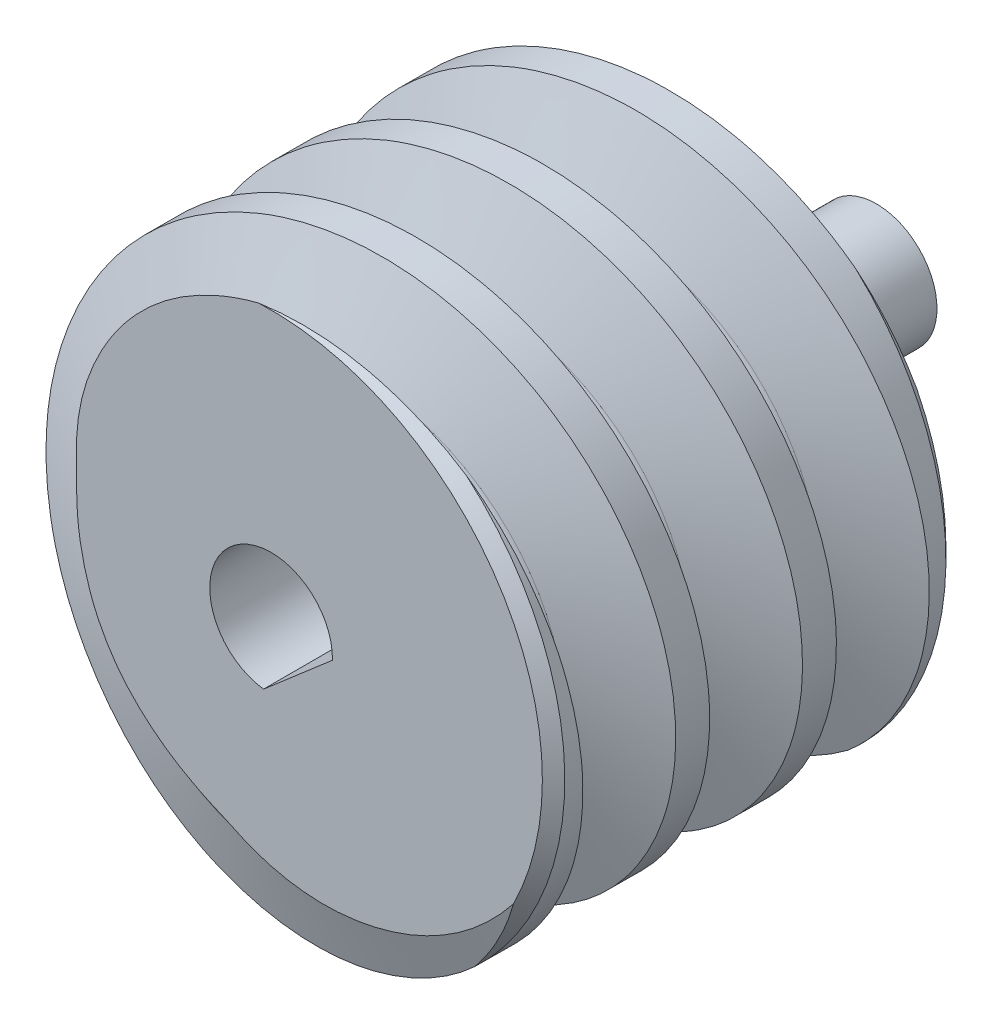
from build123d import *

# Parameters (mm, degrees)
TOOTHCUTWORM01_PITCH = 3.141592606
CUT_EXTRUDE_1_DEPTH  = 15.071247435
SKETCH_4_R           = 2.5
SKETCH_4_R_2         = 1.5
EXTRUDE_2_DEPTH      = 1
EXTRUDE_START        = -1
EXTRUDE_3_DEPTH      = 6


with BuildPart() as part:
    # SketchRevolveWorm01 → Worm01 (revolve)
    with BuildSketch(Plane(origin=(0, 0, 0), x_dir=(0, 0, -1), z_dir=(1, 0, 0)), mode=Mode.PRIVATE) as worm01_sk:
        Polygon((5, 0), (5, 6.721999985), (4.722, 6.999999985), (-4.722, 6.999999985), (-5, 6.721999985), (-5, 0), align=None)
    revolve(worm01_sk.sketch.rotate(Axis((0, 0, 0), (0, 0, -1)), 90), axis=Axis((0, 0, 0), (0, 0, -1)))

    # ToothCutWorm01: the profile of SketchToothWorm01 screwed along a right-hand helix of 6 turns, 10 arcs to a turn; built about Z, then put on its axis
    toothcutworm01_z = Axis((0, 0, 0), (0, 0, 1))
    toothcutworm01_corners = [(7.249999981, 0, 1.242074472), (4.947052957, 0, 0.400713361), (4.750000019, 0, 0.118929933), (4.750000019, 0, -0.118929933), (4.947052957, 0, -0.400713361), (7.249999981, 0, -1.242074472)]
    with BuildLine(mode=Mode.PRIVATE) as toothcutworm01_profile:
        Line(toothcutworm01_corners[0], toothcutworm01_corners[1])
        Line(toothcutworm01_corners[2], toothcutworm01_corners[3])
        Line(toothcutworm01_corners[4], toothcutworm01_corners[5])
        Line(toothcutworm01_corners[5], toothcutworm01_corners[0])
        ThreePointArc((4.947052957, 0, 0.400713361), (4.804150351, 0, 0.290854161), (4.750000019, 0, 0.118929933))
        ThreePointArc((4.750000019, 0, -0.118929933), (4.804150351, 0, -0.290854161), (4.947052957, 0, -0.400713361))
    toothcutworm01_cap = Face(toothcutworm01_profile.wire())
    toothcutworm01_arcs = [((4.947052957, 0, 0.400713361), (4.750000019, 0, 0.328721832), (4.750000019, 0, 0.118929933), (1, 0.8194988901063853, 1)), ((4.750000019, 0, -0.118929933), (4.750000019, 0, -0.328721832), (4.947052957, 0, -0.400713361), (1, 0.8194988901063811, 1))]  # start, shoulder, end, weights
    toothcutworm01_turn_angles = [0, 18, 36, 54, 72, 90, 108, 126, 144, 162, 180, 198, 216, 234, 252, 270, 288, 306, 324, 342, 360]
    toothcutworm01_turn_weights = [1, 0.9510565162951535, 1, 0.9510565162951535, 1, 0.9510565162951535, 1, 0.9510565162951535, 1, 0.9510565162951535, 1, 0.9510565162951535, 1, 0.9510565162951535, 1, 0.9510565162951535, 1, 0.9510565162951535, 1, 0.9510565162951535, 1]
    toothcutworm01_turn_rails = [Edge.make_bspline([Vector(p[0], p[1], 0).rotate(toothcutworm01_z, toothcutworm01_turn_angles[k]) / toothcutworm01_turn_weights[k] + Vector(0, 0, p[2] + TOOTHCUTWORM01_PITCH * toothcutworm01_turn_angles[k] / 360) for k in range(21)], [0, 0, 0, 1, 1, 2, 2, 3, 3, 4, 4, 5, 5, 6, 6, 7, 7, 8, 8, 9, 9, 10, 10, 10], 2, toothcutworm01_turn_weights) for p in toothcutworm01_corners]
    toothcutworm01_turn_sides = [*[Face.make_surface_from_curves(toothcutworm01_turn_rails[p[0]], toothcutworm01_turn_rails[p[1]]) for p in [(0, 1), (2, 3), (4, 5), (5, 0)]], *[Face.make_bezier_surface([[Vector(p[j][0], p[j][1], 0).rotate(toothcutworm01_z, toothcutworm01_turn_angles[2 * i + k]) / toothcutworm01_turn_weights[2 * i + k] + Vector(0, 0, p[j][2] + TOOTHCUTWORM01_PITCH * toothcutworm01_turn_angles[2 * i + k] / 360) for k in range(3)] for j in range(3)], [[p[3][j] * toothcutworm01_turn_weights[2 * i + k] for k in range(3)] for j in range(3)]) for p in toothcutworm01_arcs for i in range(10)]]
    toothcutworm01 = Plane(origin=(0, 0, 9.424777819), x_dir=(1, 0, 0), z_dir=(0, 0, -1)) * Solid(Shell([*[p.moved(Location((0, 0, TOOTHCUTWORM01_PITCH * i))) for i in range(6) for p in toothcutworm01_turn_sides], toothcutworm01_cap, toothcutworm01_cap.rotate(toothcutworm01_z, 2160).moved(Location((0, 0, TOOTHCUTWORM01_PITCH * 2160 / 360)))]))
    add(toothcutworm01, mode=Mode.SUBTRACT)

    # Эскиз1 → Вырез-Вытянуть1 (cut, through all)
    with BuildSketch(Plane(origin=(0, 0, -5), x_dir=(-1, 0, 0), z_dir=(0, 0, -1))):
        with BuildLine():
            Line((-1.519579541, -0.035749375), (0.186583259, -1.508504785))
            ThreePointArc((0.186583259, -1.508504785), (0.993212916, 1.150620747), (-1.519579541, -0.035749375))
        make_face()
    extrude(amount=-CUT_EXTRUDE_1_DEPTH, mode=Mode.SUBTRACT)

    # Эскиз4 → Бобышка-Вытянуть2 (add)
    with BuildSketch(Plane(origin=(0, 0, -5), x_dir=(-1, 0, 0), z_dir=(0, 0, -1))):
        with Locations(Location((0, 0, 0), (0, 0, 180))):
            Circle(SKETCH_4_R)
        with Locations(Location((0, 0, 0), (0, 0, 182.042965916))):
            Circle(SKETCH_4_R_2, mode=Mode.SUBTRACT)
    extrude(amount=EXTRUDE_2_DEPTH)

    # Эскиз4<2> → Бобышка-Вытянуть3 (add)
    with BuildSketch(Plane(origin=(0, 0, -5), x_dir=(-1, 0, 0), z_dir=(0, 0, -1)).offset(EXTRUDE_START)):
        with BuildLine():
            ThreePointArc((0.16605028, -1.49078077), (1.117827227, -1.000231118), (1.5, 0))
            ThreePointArc((1.5, 0), (-0.026740945, 1.499761622), (-1.499046563, -0.05347339))
            Line((-1.499046563, -0.05347339), (0.16605028, -1.49078077))
        make_face()
        with BuildLine():
            Line((0.16605028, -1.49078077), (-1.499046563, -0.05347339))
            ThreePointArc((-1.499046563, -0.05347339), (-0.980144325, -1.135481), (0.16605028, -1.49078077))
        make_face()
    extrude(amount=EXTRUDE_3_DEPTH)


solid = part.part
